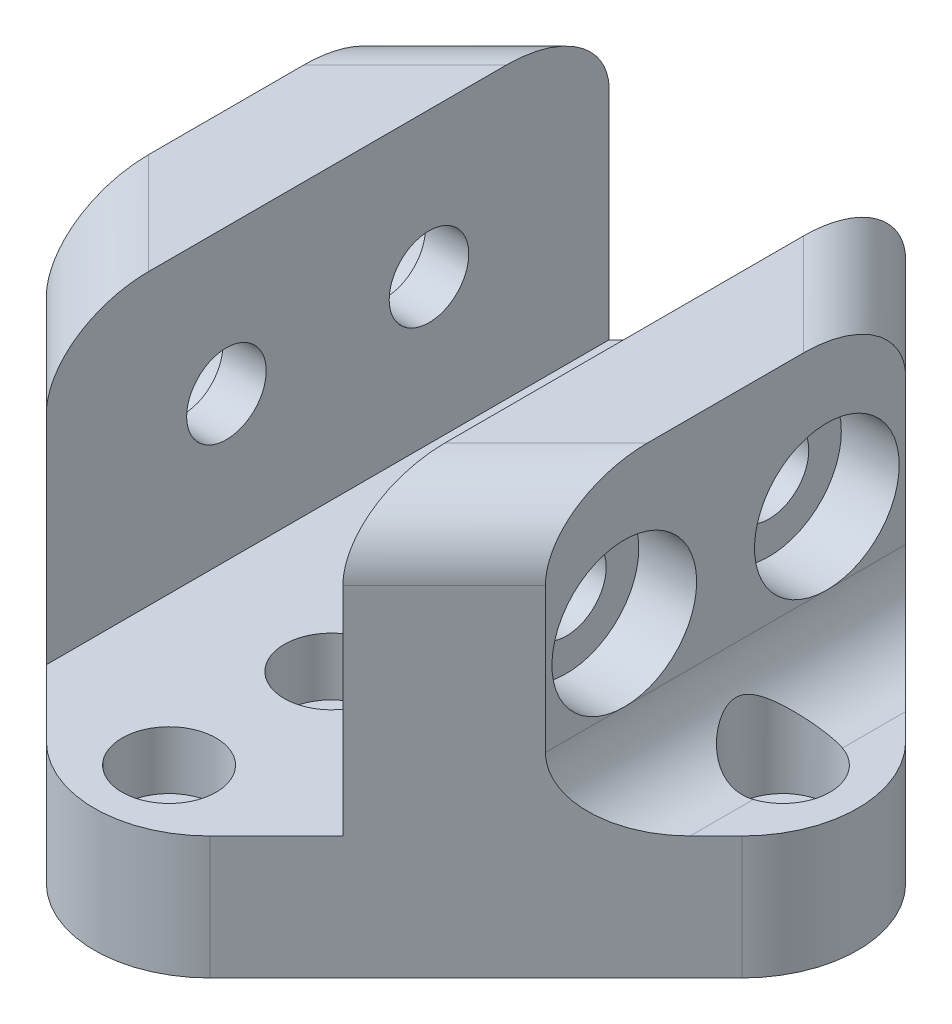
from build123d import *

# Parameters (mm, degrees)
SKETCH_1_R          = 1.75
EXTRUDE_1_DEPTH     = 8.5
EXTRUDE_2_DEPTH     = 20
SKETCH_3_R          = 2.75
CUT_EXTRUDE_1_DEPTH = 59.415752368
SKETCH_4_R          = 5
CUT_EXTRUDE_2_DEPTH = 4
SKETCH_5_R          = 3.25
CUT_EXTRUDE_3_DEPTH = 4
FILLET_2_R          = 5


with BuildPart() as part:
    # Эскиз1 → Бобышка-Вытянуть1 (new body)
    with BuildSketch(Plane(origin=(0, 0, 0), x_dir=(1, 0, 0), z_dir=(0, 1, 0))):
        with BuildLine():
            Line((5.656854249, -24.04163056), (24.04163056, -5.656854249))
            ThreePointArc((24.04163056, -5.656854249), (26.384776311, 0), (24.04163056, 5.656854249))
            Line((24.04163056, 5.656854249), (5.656854249, 24.04163056))
            ThreePointArc((5.656854249, 24.04163056), (0, 26.384776311), (-5.656854249, 24.04163056))
            Line((-5.656854249, 24.04163056), (-24.04163056, 5.656854249))
            ThreePointArc((-24.04163056, 5.656854249), (-26.384776311, 0), (-24.04163056, -5.656854249))
            Line((-24.04163056, -5.656854249), (-5.656854249, -24.04163056))
            ThreePointArc((-5.656854249, -24.04163056), (0, -26.384776311), (5.656854249, -24.04163056))
        make_face()
        with Locations(Location((21.213203436, 0, 0), (0, 0, 270))):
            Circle(SKETCH_1_R, mode=Mode.SUBTRACT)
        with Locations(Location((0, -10, 0), (0, 0, 270))):
            Circle(SKETCH_1_R, mode=Mode.SUBTRACT)
        with Locations(Location((0, -21.213203436, 0), (0, 0, 270))):
            Circle(SKETCH_1_R, mode=Mode.SUBTRACT)
        with Locations(Location((-21.213203436, 0, 0), (0, 0, 270))):
            Circle(SKETCH_1_R, mode=Mode.SUBTRACT)
        with Locations(Location((0, 10, 0), (0, 0, 270))):
            Circle(SKETCH_1_R, mode=Mode.SUBTRACT)
        with Locations(Location((0, 21.213203436, 0), (0, 0, 270))):
            Circle(SKETCH_1_R, mode=Mode.SUBTRACT)
    extrude(amount=EXTRUDE_1_DEPTH)

    # Эскиз2 → Бобышка-Вытянуть2 (add)
    with BuildSketch(Plane(origin=(0, 8.5, 0), x_dir=(1, 0, 0), z_dir=(0, 1, 0))):
        Polygon((-10.25, 19.44848481), (-10.25, -19.44848481), (-17.25, -12.44848481), (-17.25, 12.44848481), align=None)
        Polygon((17.25, 12.44848481), (10.25, 19.44848481), (10.25, -19.44848481), (17.25, -12.44848481), align=None)
    extrude(amount=EXTRUDE_2_DEPTH)

    # Эскиз3 → Вырез-Вытянуть1 (cut, through all)
    with BuildSketch(Plane(origin=(17.25, 0, 0), x_dir=(0, 0, -1), z_dir=(1, 0, 0))):
        with Locations((-7, 18.5)):
            Circle(SKETCH_3_R)
        with Locations((7, 18.5)):
            Circle(SKETCH_3_R)
    extrude(amount=-CUT_EXTRUDE_1_DEPTH, mode=Mode.SUBTRACT)

    # Эскиз4 → Вырез-Вытянуть2 (cut)
    with BuildSketch(Plane(origin=(17.25, 0, 0), x_dir=(0, 0, -1), z_dir=(1, 0, 0))):
        with Locations((-7, 18.5)):
            Circle(SKETCH_4_R)
        with Locations((7, 18.5)):
            Circle(SKETCH_4_R)
    cut_extrude_2 = extrude(amount=-CUT_EXTRUDE_2_DEPTH, mode=Mode.SUBTRACT)

    # Зеркальное отражение1: Вырез-Вытянуть2 across plane
    add(cut_extrude_2.mirror(Plane(origin=(0, 0, 0), x_dir=(0, 0, 1), z_dir=(1, 0, 0))), mode=Mode.SUBTRACT)

    # Эскиз5 → Вырез-Вытянуть3 (cut)
    with BuildSketch(Plane(origin=(0, 8.5, 0), x_dir=(1, 0, 0), z_dir=(0, 1, 0))):
        with Locations(Location((0, 21.213203436, 0), (0, 0, 270))):
            Circle(SKETCH_5_R)
        with Locations(Location((0, 10, 0), (0, 0, 270))):
            Circle(SKETCH_5_R)
        with Locations(Location((0, -10, 0), (0, 0, 270))):
            Circle(SKETCH_5_R)
        with Locations(Location((0, -21.213203436, 0), (0, 0, 270))):
            Circle(SKETCH_5_R)
        with Locations(Location((21.213203436, 0, 0), (0, 0, 270))):
            Circle(SKETCH_5_R)
        with Locations(Location((-21.213203436, 0, 0), (0, 0, 270))):
            Circle(SKETCH_5_R)
    extrude(amount=-CUT_EXTRUDE_3_DEPTH, mode=Mode.SUBTRACT)

    # Скругление2
    # the kernel refuses this fillet: 5 mm, written as the material it adds along each edge
    with BuildSketch(Plane(origin=(-17.25, 8.5, 24.94848481), x_dir=(-1, 0, 0), z_dir=(0, 0, -1))) as fillet_2_piece_1_section:
        with BuildLine():
            CenterArc((FILLET_2_R, FILLET_2_R), FILLET_2_R, 180, 90)
            Line((0, FILLET_2_R), (0, 0))
            Line((0, 0), (FILLET_2_R, 0))
        make_face()
    fillet_2_piece_1 = extrude(amount=49.89696962, mode=Mode.PRIVATE)
    fillet_2_piece_1 = split(fillet_2_piece_1, bisect_by=Plane(origin=(-29.470144139, 8.621513924, 0.22834067), z_dir=(0.7071067811865474, 0, -0.7071067811865477)), keep=Keep.TOP, mode=Mode.PRIVATE)
    fillet_2_piece_1 = split(fillet_2_piece_1, bisect_by=Plane(origin=(-21.171154266, 8.621513924, -8.527330544), z_dir=(0.7071067811865477, 0, 0.7071067811865474)), keep=Keep.TOP, mode=Mode.PRIVATE)
    fillet_2_piece_1 = fillet_2_piece_1 - Plane(origin=(-21.213203436, 8.621513924, 0), x_dir=(0, 0, 1), z_dir=(0, 1, 0)) * Cylinder(3.25, 120, mode=Mode.PRIVATE)
    add(fillet_2_piece_1)
    with BuildSketch(Plane(origin=(17.25, 8.5, 24.94848481), x_dir=(0, 1, 0), z_dir=(0, 0, -1))) as fillet_2_piece_2_section:
        with BuildLine():
            CenterArc((FILLET_2_R, FILLET_2_R), FILLET_2_R, 180, 90)
            Line((0, FILLET_2_R), (0, 0))
            Line((0, 0), (FILLET_2_R, 0))
        make_face()
    fillet_2_piece_2 = extrude(amount=49.89696962, mode=Mode.PRIVATE)
    fillet_2_piece_2 = split(fillet_2_piece_2, bisect_by=Plane(origin=(27.68449432, 12.192813605, 2.013990489), z_dir=(-0.7071067811865477, 0, -0.7071067811865474)), keep=Keep.TOP, mode=Mode.PRIVATE)
    fillet_2_piece_2 = split(fillet_2_piece_2, bisect_by=Plane(origin=(19.385504447, 12.192813605, -10.312980363), z_dir=(-0.7071067811865472, 0, 0.7071067811865478)), keep=Keep.TOP, mode=Mode.PRIVATE)
    fillet_2_piece_2 = fillet_2_piece_2 - Plane(origin=(21.213203436, 12.192813605, 0), x_dir=(0, 0, 1), z_dir=(0, 1, 0)) * Cylinder(3.25, 120, mode=Mode.PRIVATE)
    add(fillet_2_piece_2)
    # the kernel refuses this fillet: 5 mm, written as the material it takes off along each edge
    with BuildSketch(Plane(origin=(-26.088834765, 28.5, -3.609650045), x_dir=(0, -1, 0), z_dir=(0.7071067811865472, 0, -0.7071067811865478)), Plane(origin=(1.411165235, 28.5, 28.287319575), x_dir=(-0.7071067811865474, 0, -0.7071067811865477), z_dir=(0.7071067811865477, 0, -0.7071067811865474))) as fillet_2_2_piece_1:
        with BuildLine():
            CenterArc((FILLET_2_R, -FILLET_2_R), FILLET_2_R, 90, 90)
            Line((0, -FILLET_2_R), (0, 0))
            Line((0, 0), (FILLET_2_R, 0))
        make_face()
    extrude(amount=34.899494937, mode=Mode.SUBTRACT)
    with BuildSketch(Plane(origin=(-1.411165235, 28.5, 28.287319575), x_dir=(0.7071067811865474, 0, -0.7071067811865477), z_dir=(-0.7071067811865477, 0, -0.7071067811865474)), Plane(origin=(26.088834765, 28.5, -3.609650045), x_dir=(0, -1, 0), z_dir=(-0.7071067811865472, 0, -0.7071067811865478))) as fillet_2_2_piece_2:
        with BuildLine():
            CenterArc((FILLET_2_R, FILLET_2_R), FILLET_2_R, 180, 90)
            Line((0, FILLET_2_R), (0, 0))
            Line((0, 0), (FILLET_2_R, 0))
        make_face()
    extrude(amount=34.899494937, mode=Mode.SUBTRACT)


solid = part.part
